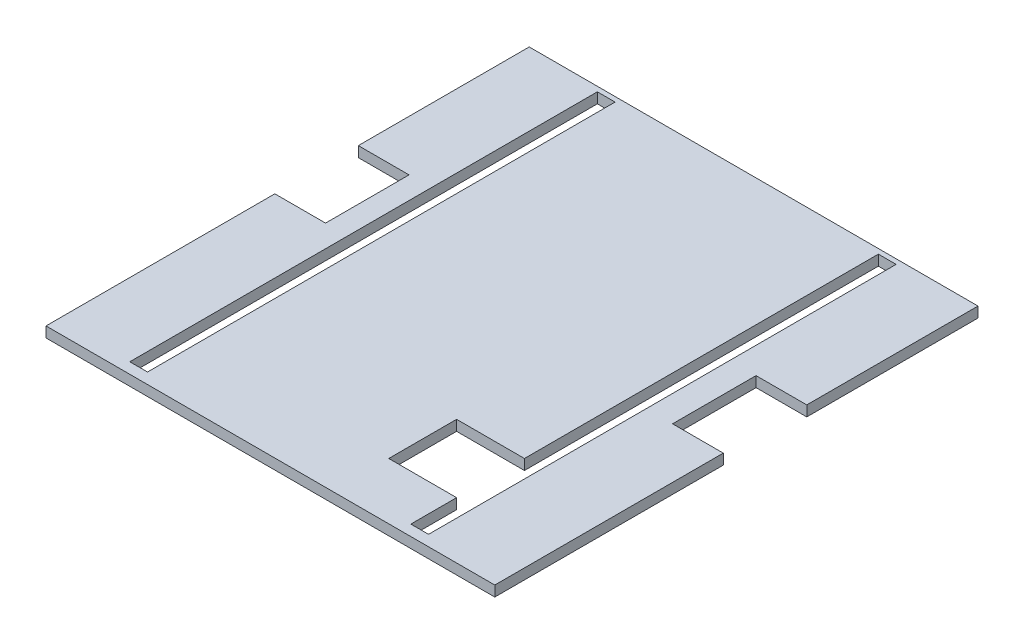
from build123d import *

# Parameters (mm, degrees)
SKETCH1_W           = 430
SKETCH1_H           = 463
BOSS_EXTRUDE1_DEPTH = 10
SKETCH2_W           = 48.6
SKETCH2_H           = 80
CUT_EXTRUDE1_DEPTH  = 10
SKETCH3_W           = 17
SKETCH3_H           = 448
CUT_EXTRUDE2_DEPTH  = 10
SKETCH4_W           = 65
SKETCH4_H           = 65
CUT_EXTRUDE3_DEPTH  = 10


with BuildPart() as part:
    # Sketch1 → Boss-Extrude1 (new body)
    with BuildSketch(Plane(origin=(0, 0, 0), x_dir=(1, 0, 0), z_dir=(0, 1, 0))):
        with Locations((6126.084066999, -8720.812377786)):
            Rectangle(SKETCH1_W, SKETCH1_H)
    extrude(amount=BOSS_EXTRUDE1_DEPTH)

    # Sketch2 → Cut-Extrude1 (cut)
    with BuildSketch(Plane(origin=(0, 10, 0), x_dir=(1, 0, 0), z_dir=(0, 1, 0))):
        with Locations((5935.384066999, -8693.059787309)):
            Rectangle(SKETCH2_W, SKETCH2_H)
        with Locations((6316.784066999, -8693.384418705)):
            Rectangle(SKETCH2_W, SKETCH2_H)
    extrude(amount=-CUT_EXTRUDE1_DEPTH, mode=Mode.SUBTRACT)

    # Sketch3 → Cut-Extrude2 (cut)
    with BuildSketch(Plane(origin=(0, 10, 0), x_dir=(1, 0, 0), z_dir=(0, 1, 0))):
        with Locations((6258.792759281, -8717.974964433)):
            Rectangle(SKETCH3_W, SKETCH3_H)
        with Locations((5989.464731885, -8717.910291629)):
            Rectangle(SKETCH3_W, SKETCH3_H)
    extrude(amount=-CUT_EXTRUDE2_DEPTH, mode=Mode.SUBTRACT)

    # Sketch4 → Cut-Extrude3 (cut)
    with BuildSketch(Plane(origin=(0, 10, 0), x_dir=(1, 0, 0), z_dir=(0, 1, 0))):
        with Locations((6217.792759281, -8865.596518708)):
            Rectangle(SKETCH4_W, SKETCH4_H)
    extrude(amount=-CUT_EXTRUDE3_DEPTH, mode=Mode.SUBTRACT)


solid = part.part
